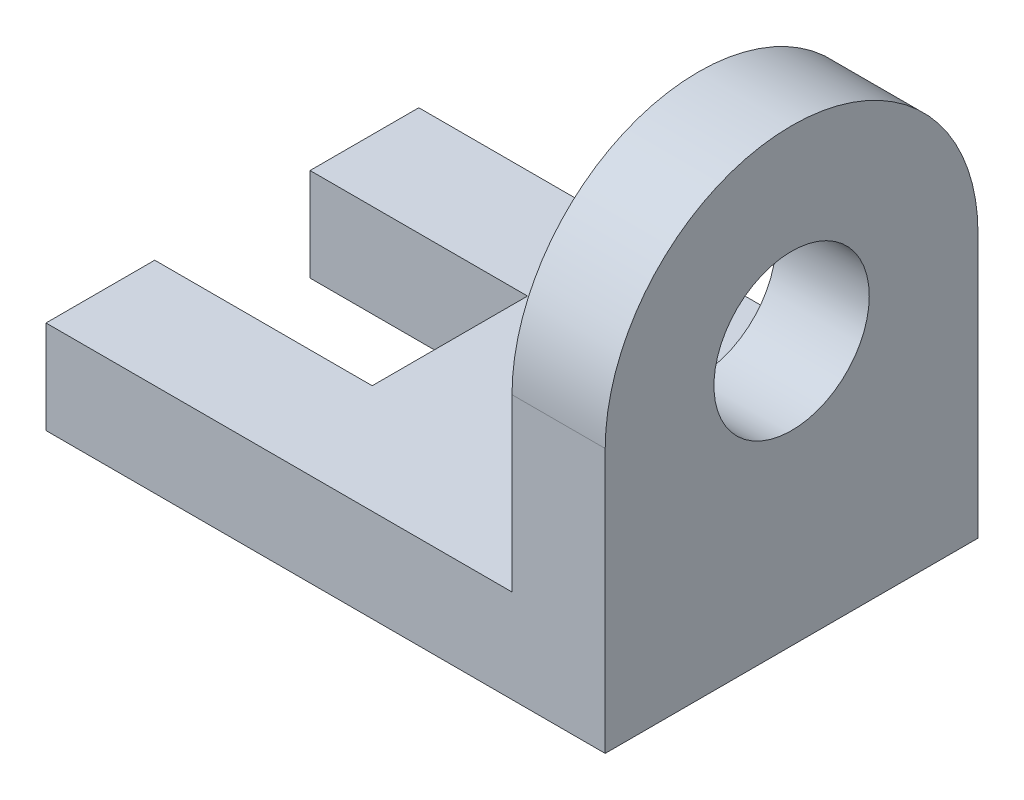
from build123d import *

# Parameters (mm, degrees)
EXTRUDE_1_DEPTH     = 24
SKETCH_2_W          = 14
SKETCH_2_H          = 10
CUT_EXTRUDE_1_DEPTH = 24
CUT_EXTRUDE_2_DEPTH = 24
SKETCH_5_R          = 5
CUT_EXTRUDE_3_DEPTH = 24


with BuildPart() as part:
    # 草图1 → 凸台-拉伸1 (new body)
    with BuildSketch(Plane.XY):
        Polygon((0, 0), (36, 0), (36, 29), (30, 29), (30, 6), (0, 6), align=None)
    extrude(amount=EXTRUDE_1_DEPTH)

    # 草图2 → 切除-拉伸1 (cut)
    with BuildSketch(Plane(origin=(0, 6, 0), x_dir=(1, 0, 0), z_dir=(0, 1, 0))):
        with Locations((7, -12)):
            Rectangle(SKETCH_2_W, SKETCH_2_H)
    extrude(amount=-CUT_EXTRUDE_1_DEPTH, mode=Mode.SUBTRACT)

    # 草图3 → 切除-拉伸2 (cut)
    with BuildSketch(Plane(origin=(36, 0, 0), x_dir=(0, 0, -1), z_dir=(1, 0, 0))):
        with BuildLine():
            Line((0, 17), (0, 29))
            Line((0, 29), (-12, 29))
            ThreePointArc((-12, 29), (-3.514718626, 25.485281374), (0, 17))
        make_face()
        with BuildLine():
            ThreePointArc((-24, 17), (-20.485281374, 25.485281374), (-12, 29))
            Line((-12, 29), (-24, 29))
            Line((-24, 29), (-24, 17))
        make_face()
    extrude(amount=-CUT_EXTRUDE_2_DEPTH, mode=Mode.SUBTRACT)

    # 草图5 → 切除-拉伸3 (cut)
    with BuildSketch(Plane(origin=(36, 0, 0), x_dir=(0, 0, -1), z_dir=(1, 0, 0))):
        with Locations((-12, 17)):
            Circle(SKETCH_5_R)
    extrude(amount=-CUT_EXTRUDE_3_DEPTH, mode=Mode.SUBTRACT)


solid = part.part
